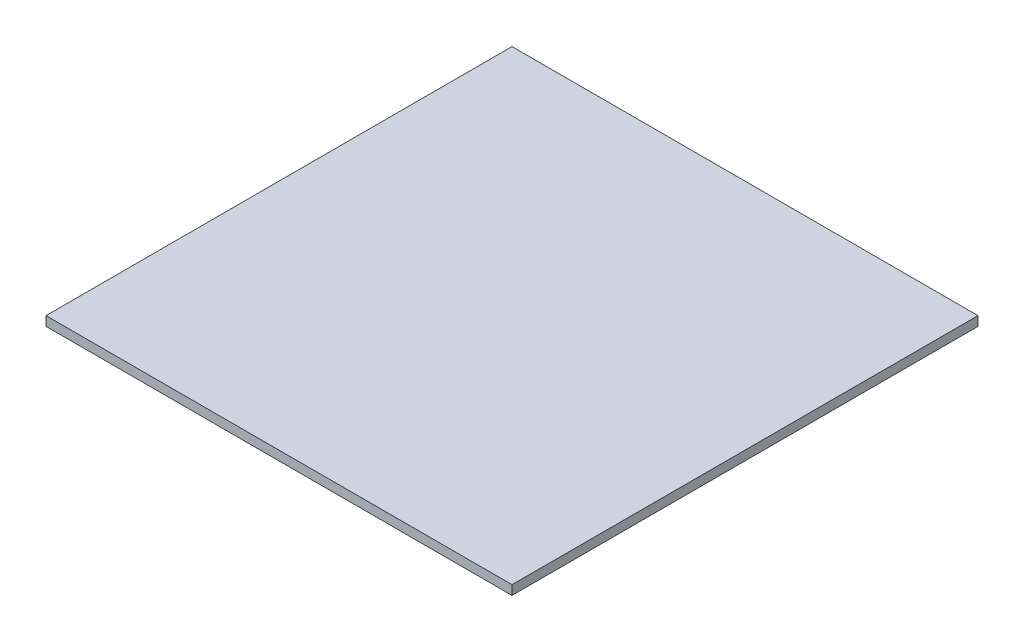
from build123d import *

# Parameters (mm, degrees)
CROQUIS1_W              = 200
CROQUIS1_H              = 200
SALIENTE_EXTRUIR1_DEPTH = 4


with BuildPart() as part:
    # Croquis1 → Saliente-Extruir1 (new body)
    with BuildSketch(Plane(origin=(0, 0, 0), x_dir=(1, 0, 0), z_dir=(0, 1, 0))):
        Rectangle(CROQUIS1_W, CROQUIS1_H)
    extrude(amount=SALIENTE_EXTRUIR1_DEPTH)


solid = part.part
